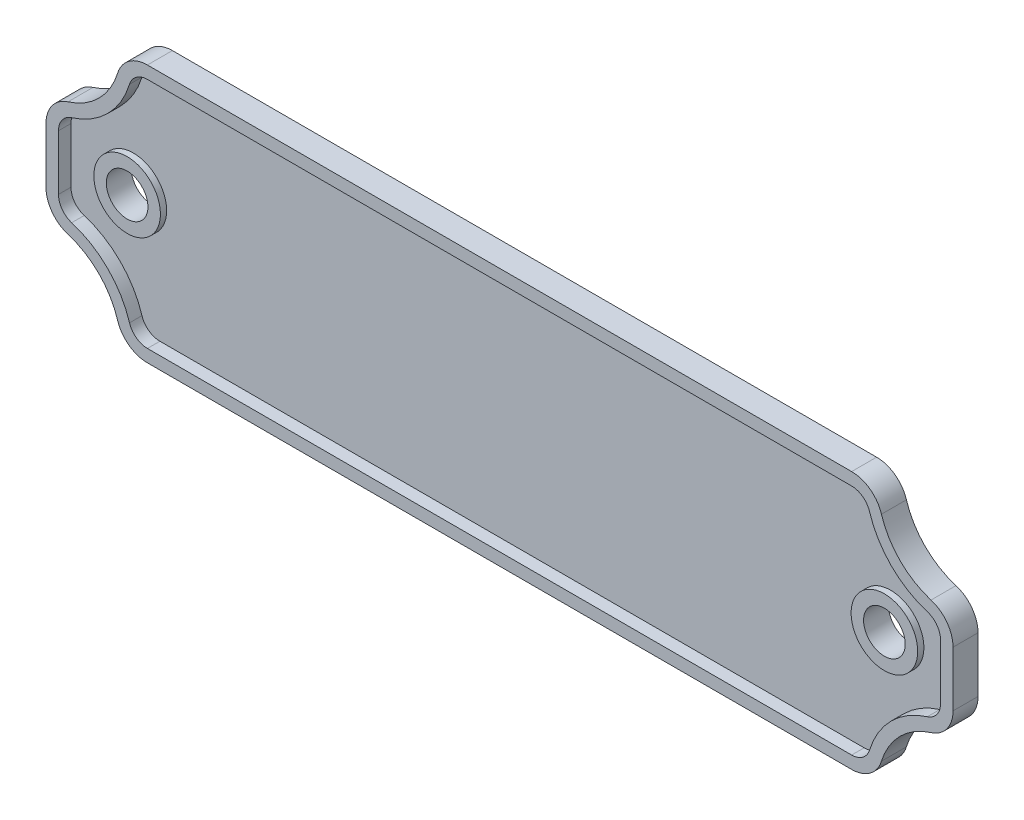
from build123d import *

# Parameters (mm, degrees)
SKETCH1_R           = 4
SKETCH1_R_2         = 2.5
BOSS_EXTRUDE3_DEPTH = 1.5
BOSS_EXTRUDE4_DEPTH = 3
BOSS_EXTRUDE5_START = -0.75
SKETCH1_6_R         = 4
SKETCH1_6_R_2       = 2.5
BOSS_EXTRUDE5_DEPTH = 3


with BuildPart() as part:
    # Sketch1 → Boss-Extrude3 (new body)
    with BuildSketch(Plane.XY):
        with BuildLine():
            ThreePointArc((51.852941176, -6.898076983), (53.76649875, -5.541774365), (54.5, -3.313942393))
            Line((54.5, -3.313942393), (54.5, 3.313942393))
            ThreePointArc((54.5, 3.313942393), (53.76649875, 5.541774365), (51.852941176, 6.898076983))
            ThreePointArc((51.852941176, 6.898076983), (48.136038969, 9.136038969), (45.898076983, 12.852941176))
            ThreePointArc((45.898076983, 12.852941176), (44.541774365, 14.76649875), (42.313942393, 15.5))
            Line((42.313942393, 15.5), (-42.313942393, 15.5))
            ThreePointArc((-42.313942393, 15.5), (-44.541774365, 14.76649875), (-45.898076983, 12.852941176))
            ThreePointArc((-45.898076983, 12.852941176), (-48.136038969, 9.136038969), (-51.852941176, 6.898076983))
            ThreePointArc((-51.852941176, 6.898076983), (-53.76649875, 5.541774365), (-54.5, 3.313942393))
            Line((-54.5, 3.313942393), (-54.5, -3.313942393))
            ThreePointArc((-54.5, -3.313942393), (-53.76649875, -5.541774365), (-51.852941176, -6.898076983))
            ThreePointArc((-51.852941176, -6.898076983), (-48.136038969, -9.136038969), (-45.898076983, -12.852941176))
            ThreePointArc((-45.898076983, -12.852941176), (-44.541774365, -14.76649875), (-42.313942393, -15.5))
            Line((-42.313942393, -15.5), (42.313942393, -15.5))
            ThreePointArc((42.313942393, -15.5), (44.541774365, -14.76649875), (45.898076983, -12.852941176))
            ThreePointArc((45.898076983, -12.852941176), (48.136038969, -9.136038969), (51.852941176, -6.898076983))
        make_face()
        with Locations((45.5, 0)):
            Circle(SKETCH1_R, mode=Mode.SUBTRACT)
        with Locations((-45.5, 0)):
            Circle(SKETCH1_R_2, mode=Mode.SUBTRACT)
    extrude(amount=BOSS_EXTRUDE3_DEPTH)

    # Sketch1<3> → Boss-Extrude4 (add)
    with BuildSketch(Plane.XY):
        with BuildLine():
            ThreePointArc((51.852941176, -6.898076983), (53.76649875, -5.541774365), (54.5, -3.313942393))
            Line((54.5, -3.313942393), (54.5, 3.313942393))
            ThreePointArc((54.5, 3.313942393), (53.76649875, 5.541774365), (51.852941176, 6.898076983))
            ThreePointArc((51.852941176, 6.898076983), (48.136038969, 9.136038969), (45.898076983, 12.852941176))
            ThreePointArc((45.898076983, 12.852941176), (44.541774365, 14.76649875), (42.313942393, 15.5))
            Line((42.313942393, 15.5), (-42.313942393, 15.5))
            ThreePointArc((-42.313942393, 15.5), (-44.541774365, 14.76649875), (-45.898076983, 12.852941176))
            ThreePointArc((-45.898076983, 12.852941176), (-48.136038969, 9.136038969), (-51.852941176, 6.898076983))
            ThreePointArc((-51.852941176, 6.898076983), (-53.76649875, 5.541774365), (-54.5, 3.313942393))
            Line((-54.5, 3.313942393), (-54.5, -3.313942393))
            ThreePointArc((-54.5, -3.313942393), (-53.76649875, -5.541774365), (-51.852941176, -6.898076983))
            ThreePointArc((-51.852941176, -6.898076983), (-48.136038969, -9.136038969), (-45.898076983, -12.852941176))
            ThreePointArc((-45.898076983, -12.852941176), (-44.541774365, -14.76649875), (-42.313942393, -15.5))
            Line((-42.313942393, -15.5), (42.313942393, -15.5))
            ThreePointArc((42.313942393, -15.5), (44.541774365, -14.76649875), (45.898076983, -12.852941176))
            ThreePointArc((45.898076983, -12.852941176), (48.136038969, -9.136038969), (51.852941176, -6.898076983))
        make_face()
        with BuildLine():
            Line((53, 3.313942393), (53, -3.313942393))
            ThreePointArc((53, -3.313942393), (52.55989925, -4.650641576), (51.411764706, -5.464423147))
            ThreePointArc((51.411764706, -5.464423147), (47.075378798, -8.075378798), (44.464423147, -12.411764706))
            ThreePointArc((44.464423147, -12.411764706), (43.650641576, -13.55989925), (42.313942393, -14))
            Line((42.313942393, -14), (-42.313942393, -14))
            ThreePointArc((-42.313942393, -14), (-43.650641576, -13.55989925), (-44.464423147, -12.411764706))
            ThreePointArc((-44.464423147, -12.411764706), (-47.075378798, -8.075378798), (-51.411764706, -5.464423147))
            ThreePointArc((-51.411764706, -5.464423147), (-52.55989925, -4.650641576), (-53, -3.313942393))
            Line((-53, -3.313942393), (-53, 3.313942393))
            ThreePointArc((-53, 3.313942393), (-52.55989925, 4.650641576), (-51.411764706, 5.464423147))
            ThreePointArc((-51.411764706, 5.464423147), (-47.075378798, 8.075378798), (-44.464423147, 12.411764706))
            ThreePointArc((-44.464423147, 12.411764706), (-43.650641576, 13.55989925), (-42.313942393, 14))
            Line((-42.313942393, 14), (42.313942393, 14))
            ThreePointArc((42.313942393, 14), (43.650641576, 13.55989925), (44.464423147, 12.411764706))
            ThreePointArc((44.464423147, 12.411764706), (47.075378798, 8.075378798), (51.411764706, 5.464423147))
            ThreePointArc((51.411764706, 5.464423147), (52.55989925, 4.650641576), (53, 3.313942393))
        make_face(mode=Mode.SUBTRACT)
    extrude(amount=BOSS_EXTRUDE4_DEPTH)

    # Sketch1<6> → Boss-Extrude5 (add)
    with BuildSketch(Plane.XY.offset(BOSS_EXTRUDE5_START)):
        with Locations((-45.5, 0)):
            Circle(SKETCH1_6_R)
        with Locations((-45.5, 0)):
            Circle(SKETCH1_6_R_2, mode=Mode.SUBTRACT)
    boss_extrude5 = extrude(amount=BOSS_EXTRUDE5_DEPTH)

    # Mirror1: Boss-Extrude5 across plane
    add(boss_extrude5.mirror(Plane(origin=(0, 0, 0), x_dir=(0, 0, 1), z_dir=(1, 0, 0))))


solid = part.part
